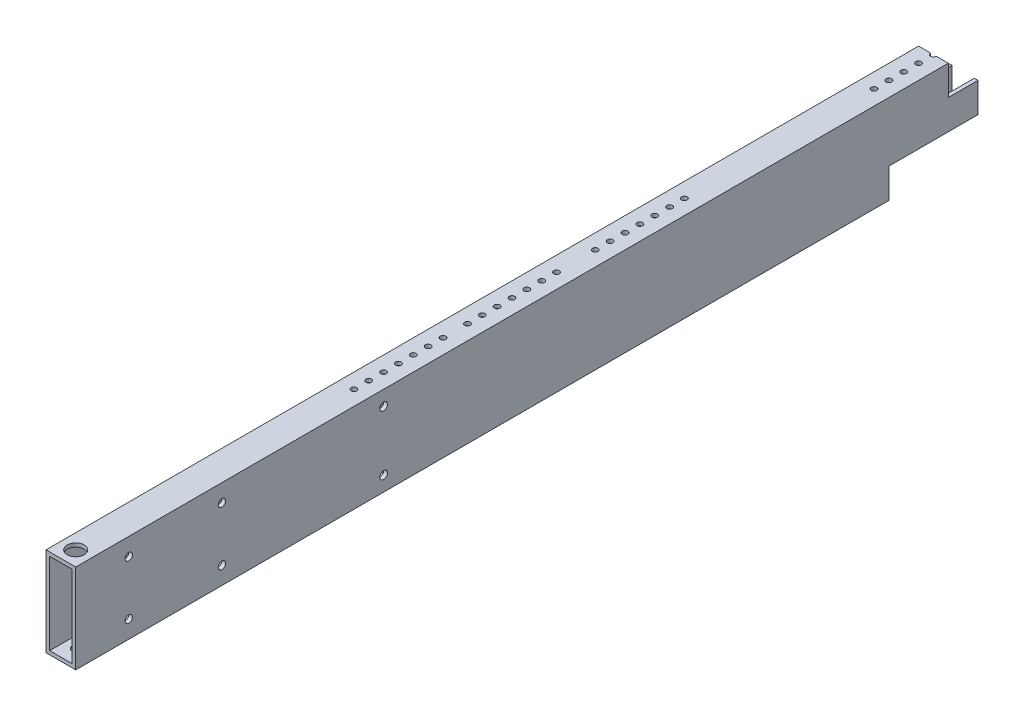
from build123d import *

# Parameters (mm, degrees)
SKETCH1_W                                    = 25.4
SKETCH1_H                                    = 76.2
BOSS_EXTRUDE1_DEPTH                          = 385.699
SHELL1_T                                     = -3.175
SKETCH2_W                                    = 76.2
SKETCH2_H                                    = 25.4
CUT_EXTRUDE1_DEPTH                           = 389.407632007
SKETCH3_W                                    = 25.4
SKETCH3_H                                    = 25.4
CUT_EXTRUDE2_DEPTH                           = 389.407632007
SKETCH4_R                                    = 2.38125
CUT_EXTRUDE3_DEPTH                           = 394.359185225
CUT_EXTRUDE4_REACH                           = 395.359
SKETCH5_R                                    = 2.38125
CUT_EXTRUDE5_REACH                           = 395.359
SKETCH6_R                                    = 2.38125
CBORE_FOR_M6_HEX_HEAD_BOLT1_D                = 6.3
CBORE_FOR_M6_HEX_HEAD_BOLT1_CBORE_D          = 14.547
CBORE_FOR_M6_HEX_HEAD_BOLT1_CBORE_DEPTH      = 4
CBORE_FOR_M6_HEX_HEAD_CAP_SCREW1_D           = 6.6
CBORE_FOR_M6_HEX_HEAD_CAP_SCREW1_CBORE_D     = 14.55
CBORE_FOR_M6_HEX_HEAD_CAP_SCREW1_CBORE_DEPTH = 4.15
CBORE_FOR_M6_HEX_HEAD_CAP_SCREW2_D           = 6.6
CBORE_FOR_M6_HEX_HEAD_CAP_SCREW2_CBORE_D     = 14.55
CBORE_FOR_M6_HEX_HEAD_CAP_SCREW2_CBORE_DEPTH = 4.15


with BuildPart() as part:
    # Sketch1 → Boss-Extrude1 (new, symmetric)
    with BuildSketch(Plane.XY):
        Rectangle(SKETCH1_W, SKETCH1_H)
    extrude(amount=BOSS_EXTRUDE1_DEPTH, both=True)

    # Shell1
    shell1_openings = [part.faces().sort_by_distance(p)[0] for p in [
        (0, 0, -385.699),
        (0, 0, 385.699),
    ]]
    offset(amount=SHELL1_T, openings=shell1_openings, kind=Kind.INTERSECTION)

    # Sketch2 → Cut-Extrude1 (cut, through all)
    with BuildSketch(Plane(origin=(12.7, 0, 0), x_dir=(0, 0, -1), z_dir=(1, 0, 0))):
        with Locations((347.599, -25.4)):
            Rectangle(SKETCH2_W, SKETCH2_H)
    extrude(amount=-CUT_EXTRUDE1_DEPTH, mode=Mode.SUBTRACT)

    # Sketch3 → Cut-Extrude2 (cut, through all)
    with BuildSketch(Plane(origin=(12.7, 0, 0), x_dir=(0, 0, -1), z_dir=(1, 0, 0))):
        with Locations((372.999, 25.4)):
            Rectangle(SKETCH3_W, SKETCH3_H)
    extrude(amount=-CUT_EXTRUDE2_DEPTH, mode=Mode.SUBTRACT)

    # Sketch4 → Cut-Extrude3 (cut, through all)
    with BuildSketch(Plane(origin=(0, 38.1, 0), x_dir=(1, 0, 0), z_dir=(0, 1, 0))):
        with Locations((0, 147.394483214)):
            Circle(SKETCH4_R)
        with Locations((0, 134.694483214)):
            Circle(SKETCH4_R)
        with Locations((0, 121.994483214)):
            Circle(SKETCH4_R)
        with Locations((0, 109.294483214)):
            Circle(SKETCH4_R)
        with Locations((0, 96.594483214)):
            Circle(SKETCH4_R)
        with Locations((0, 83.894483214)):
            Circle(SKETCH4_R)
        with Locations((0, 71.194483214)):
            Circle(SKETCH4_R)
        with Locations((0, 38.09873)):
            Circle(SKETCH4_R)
        with Locations((0, 25.39873)):
            Circle(SKETCH4_R)
        with Locations((0, 12.69873)):
            Circle(SKETCH4_R)
        with Locations((0, -0.00127)):
            Circle(SKETCH4_R)
        with Locations((0, -12.70127)):
            Circle(SKETCH4_R)
        with Locations((0, -25.40127)):
            Circle(SKETCH4_R)
        with Locations((0, -38.10127)):
            Circle(SKETCH4_R)
        with Locations((0, -58.99324371)):
            Circle(SKETCH4_R)
        with Locations((0, -71.69324371)):
            Circle(SKETCH4_R)
        with Locations((0, -84.39324371)):
            Circle(SKETCH4_R)
        with Locations((0, -97.09324371)):
            Circle(SKETCH4_R)
        with Locations((0, -109.79324371)):
            Circle(SKETCH4_R)
        with Locations((0, -122.49324371)):
            Circle(SKETCH4_R)
        with Locations((0, -135.19324371)):
            Circle(SKETCH4_R)
    extrude(amount=-CUT_EXTRUDE3_DEPTH, mode=Mode.SUBTRACT)

    # Sketch5 → Cut-Extrude4 (cut, up to next)
    with BuildSketch(Plane(origin=(0, 38.1, 0), x_dir=(1, 0, 0), z_dir=(0, 1, 0)), mode=Mode.PRIVATE) as cut_extrude4_sk1:
        with Locations((0, 360.299)):
            Circle(SKETCH5_R)
    cut_extrude4_tool1 = extrude(cut_extrude4_sk1.sketch, amount=-CUT_EXTRUDE4_REACH, mode=Mode.PRIVATE) & part.part
    # Sketch5 → Cut-Extrude4 (cut, up to next)
    with BuildSketch(Plane(origin=(0, 38.1, 0), x_dir=(1, 0, 0), z_dir=(0, 1, 0)), mode=Mode.PRIVATE) as cut_extrude4_sk2:
        with Locations((0, 347.599)):
            Circle(SKETCH5_R)
    cut_extrude4_tool2 = extrude(cut_extrude4_sk2.sketch, amount=-CUT_EXTRUDE4_REACH, mode=Mode.PRIVATE) & part.part
    # Sketch5 → Cut-Extrude4 (cut, up to next)
    with BuildSketch(Plane(origin=(0, 38.1, 0), x_dir=(1, 0, 0), z_dir=(0, 1, 0)), mode=Mode.PRIVATE) as cut_extrude4_sk3:
        with Locations((0, 334.899)):
            Circle(SKETCH5_R)
    cut_extrude4_tool3 = extrude(cut_extrude4_sk3.sketch, amount=-CUT_EXTRUDE4_REACH, mode=Mode.PRIVATE) & part.part
    # Sketch5 → Cut-Extrude4 (cut, up to next)
    with BuildSketch(Plane(origin=(0, 38.1, 0), x_dir=(1, 0, 0), z_dir=(0, 1, 0)), mode=Mode.PRIVATE) as cut_extrude4_sk4:
        with Locations((0, 322.199)):
            Circle(SKETCH5_R)
    cut_extrude4_tool4 = extrude(cut_extrude4_sk4.sketch, amount=-CUT_EXTRUDE4_REACH, mode=Mode.PRIVATE) & part.part
    # Sketch5 → Cut-Extrude4 (cut, up to next)
    with BuildSketch(Plane(origin=(0, 38.1, 0), x_dir=(1, 0, 0), z_dir=(0, 1, 0)), mode=Mode.PRIVATE) as cut_extrude4_sk5:
        with Locations((0, 309.499)):
            Circle(SKETCH5_R)
    cut_extrude4_tool5 = extrude(cut_extrude4_sk5.sketch, amount=-CUT_EXTRUDE4_REACH, mode=Mode.PRIVATE) & part.part
    add(cut_extrude4_tool1.solids().sort_by_distance((0, 38.1, -360.299))[0], mode=Mode.SUBTRACT)
    add(cut_extrude4_tool2.solids().sort_by_distance((0, 38.1, -347.599))[0], mode=Mode.SUBTRACT)
    add(cut_extrude4_tool3.solids().sort_by_distance((0, 38.1, -334.899))[0], mode=Mode.SUBTRACT)
    add(cut_extrude4_tool4.solids().sort_by_distance((0, 38.1, -322.199))[0], mode=Mode.SUBTRACT)
    add(cut_extrude4_tool5.solids().sort_by_distance((0, 38.1, -309.499))[0], mode=Mode.SUBTRACT)

    # Sketch6 → Cut-Extrude5 (cut, up to next)
    with BuildSketch(Plane.XZ.offset(38.1), mode=Mode.PRIVATE) as cut_extrude5_sk1:
        with Locations((0, -309.499)):
            Circle(SKETCH6_R)
    cut_extrude5_tool1 = extrude(cut_extrude5_sk1.sketch, amount=-CUT_EXTRUDE5_REACH, mode=Mode.PRIVATE) & part.part
    # Sketch6 → Cut-Extrude5 (cut, up to next)
    with BuildSketch(Plane.XZ.offset(38.1), mode=Mode.PRIVATE) as cut_extrude5_sk2:
        with Locations((0, -296.799)):
            Circle(SKETCH6_R)
    cut_extrude5_tool2 = extrude(cut_extrude5_sk2.sketch, amount=-CUT_EXTRUDE5_REACH, mode=Mode.PRIVATE) & part.part
    # Sketch6 → Cut-Extrude5 (cut, up to next)
    with BuildSketch(Plane.XZ.offset(38.1), mode=Mode.PRIVATE) as cut_extrude5_sk3:
        with Locations((0, -284.099)):
            Circle(SKETCH6_R)
    cut_extrude5_tool3 = extrude(cut_extrude5_sk3.sketch, amount=-CUT_EXTRUDE5_REACH, mode=Mode.PRIVATE) & part.part
    # Sketch6 → Cut-Extrude5 (cut, up to next)
    with BuildSketch(Plane.XZ.offset(38.1), mode=Mode.PRIVATE) as cut_extrude5_sk4:
        with Locations((0, -258.699)):
            Circle(SKETCH6_R)
    cut_extrude5_tool4 = extrude(cut_extrude5_sk4.sketch, amount=-CUT_EXTRUDE5_REACH, mode=Mode.PRIVATE) & part.part
    # Sketch6 → Cut-Extrude5 (cut, up to next)
    with BuildSketch(Plane.XZ.offset(38.1), mode=Mode.PRIVATE) as cut_extrude5_sk5:
        with Locations((0, -271.399)):
            Circle(SKETCH6_R)
    cut_extrude5_tool5 = extrude(cut_extrude5_sk5.sketch, amount=-CUT_EXTRUDE5_REACH, mode=Mode.PRIVATE) & part.part
    add(cut_extrude5_tool1.solids().sort_by_distance((0, -38.1, -309.499))[0], mode=Mode.SUBTRACT)
    add(cut_extrude5_tool2.solids().sort_by_distance((0, -38.1, -296.799))[0], mode=Mode.SUBTRACT)
    add(cut_extrude5_tool3.solids().sort_by_distance((0, -38.1, -284.099))[0], mode=Mode.SUBTRACT)
    add(cut_extrude5_tool4.solids().sort_by_distance((0, -38.1, -258.699))[0], mode=Mode.SUBTRACT)
    add(cut_extrude5_tool5.solids().sort_by_distance((0, -38.1, -271.399))[0], mode=Mode.SUBTRACT)

    # CBORE for M6 Hex Head Bolt1 (through all)
    with Locations(Plane.ZY.offset(12.7)):
        with Locations((260.7244, 23.1254), (260.7244, -23.1), (340.3244, 23.1254), (340.3244, -23.1)):
            CounterBoreHole(CBORE_FOR_M6_HEX_HEAD_BOLT1_D / 2, CBORE_FOR_M6_HEX_HEAD_BOLT1_CBORE_D / 2, CBORE_FOR_M6_HEX_HEAD_BOLT1_CBORE_DEPTH)

    # CBORE for M6 Hex Head Cap Screw1 (through all)
    with Locations(Plane.ZY.offset(12.7)):
        with Locations((122.46784244, 25.4), (122.46784244, -25.4)):
            CounterBoreHole(CBORE_FOR_M6_HEX_HEAD_CAP_SCREW1_D / 2, CBORE_FOR_M6_HEX_HEAD_CAP_SCREW1_CBORE_D / 2, CBORE_FOR_M6_HEX_HEAD_CAP_SCREW1_CBORE_DEPTH)

    # CBORE for M6 Hex Head Cap Screw2 (through all)
    with Locations(Plane(origin=(0, 38.1, 0), x_dir=(1, 0, 0), z_dir=(0, 1, 0))):
        with Locations((0, -372.999)):
            CounterBoreHole(CBORE_FOR_M6_HEX_HEAD_CAP_SCREW2_D / 2, CBORE_FOR_M6_HEX_HEAD_CAP_SCREW2_CBORE_D / 2, CBORE_FOR_M6_HEX_HEAD_CAP_SCREW2_CBORE_DEPTH)


solid = part.part
